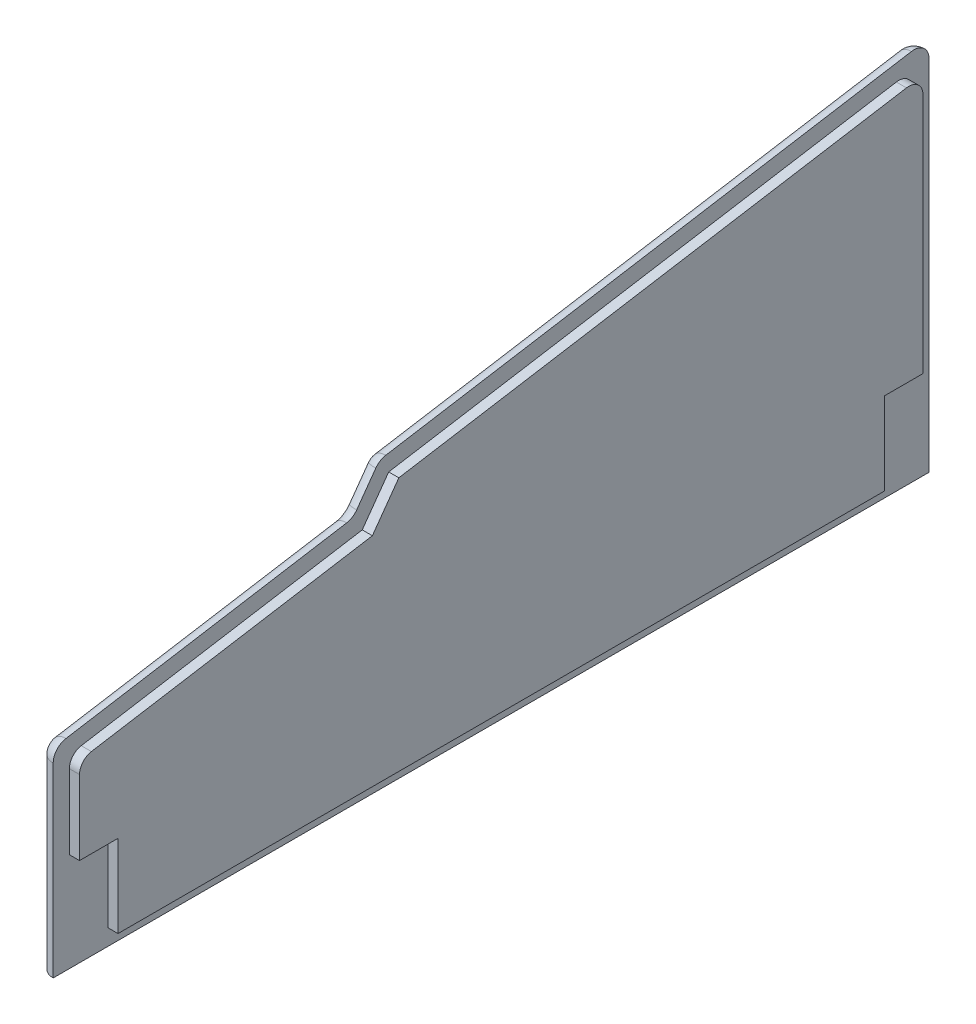
from build123d import *

# Parameters (mm, degrees)
BOSS_EXTRUDE1_DEPTH = 2
BOSS_EXTRUDE2_START = 3
BOSS_EXTRUDE2_DEPTH = 3
FILLET1_R           = 3


with BuildPart() as part:
    # Sketch1 → Boss-Extrude1 (new body)
    with BuildSketch(Plane.ZY.offset(329.974562358)):
        with BuildLine():
            Line((137.105001839, 14.690261729), (137.105001839, -0.019509128))
            Line((137.105001839, -0.019509128), (133.705001839, -0.019509128))
            Line((133.705001839, -0.019509128), (129.505001839, -0.019509128))
            Line((129.505001839, -0.019509128), (129.505001839, -16.302112125))
            Line((129.505001839, -16.302112125), (-21.848970599, -16.302112125))
            Line((-21.848970599, -16.302112125), (-21.848970599, -0.019509128))
            Line((-21.848970599, -0.019509128), (-26.048970599, -0.019509128))
            Line((-26.048970599, -0.019509128), (-29.448970599, -0.019509128))
            Line((-29.448970599, -0.019509128), (-29.448970599, 47.708117707))
            ThreePointArc((-29.448970599, 47.708117707), (-28.460366767, 49.843262649), (-26.192653512, 50.470684397))
            Line((-26.192653512, 50.470684397), (74.05116687, 33.912543624))
            Line((74.05116687, 33.912543624), (79.277875997, 26.617509644))
            Line((79.277875997, 26.617509644), (134.761318926, 17.452828418))
            ThreePointArc((134.761318926, 17.452828418), (136.440146781, 16.501657897), (137.105001839, 14.690261729))
        make_face()
    extrude(amount=-BOSS_EXTRUDE1_DEPTH)

    # Sketch1<4> → Boss-Extrude2 (add)
    # profile 1 of 3: a face of its own
    with BuildSketch(Plane.ZY.offset(329.974562358).offset(BOSS_EXTRUDE2_START)):
        with BuildLine():
            Line((-32.648970599, -19.502112125), (140.305001839, -19.502112125))
            Line((140.305001839, -19.502112125), (140.305001839, -10.219509128))
            Line((140.305001839, -10.219509128), (133.705001839, -10.219509128))
            Line((133.705001839, -10.219509128), (133.705001839, -0.219509128))
            Line((133.705001839, -0.219509128), (137.305001839, -0.219509128))
            Line((137.305001839, -0.219509128), (137.305001839, 14.690261729))
            ThreePointArc((137.305001839, 14.690261729), (136.592657134, 16.631043337), (134.793913004, 17.650154611))
            Line((134.793913004, 17.650154611), (79.39220526, 26.801334927))
            Line((79.39220526, 26.801334927), (74.165496133, 34.096368907))
            Line((74.165496133, 34.096368907), (-26.160059434, 50.668010589))
            ThreePointArc((-26.160059434, 50.668010589), (-28.589752208, 49.995773002), (-29.648970599, 47.708117707))
            Line((-29.648970599, 47.708117707), (-29.648970599, -0.219509128))
            Line((-29.648970599, -0.219509128), (-26.048970599, -0.219509128))
            Line((-26.048970599, -0.219509128), (-26.048970599, -10.219509128))
            Line((-26.048970599, -10.219509128), (-32.648970599, -10.219509128))
            Line((-32.648970599, -10.219509128), (-32.648970599, -19.502112125))
        make_face()
        with BuildLine():
            ThreePointArc((137.105001839, 14.690261729), (136.440146781, 16.501657897), (134.761318926, 17.452828418))
            Line((134.761318926, 17.452828418), (79.277875997, 26.617509644))
            Line((79.277875997, 26.617509644), (74.05116687, 33.912543624))
            Line((74.05116687, 33.912543624), (-26.192653512, 50.470684397))
            ThreePointArc((-26.192653512, 50.470684397), (-28.460366767, 49.843262649), (-29.448970599, 47.708117707))
            Line((-29.448970599, 47.708117707), (-29.448970599, -0.019509128))
            Line((-29.448970599, -0.019509128), (-26.048970599, -0.019509128))
            Line((-26.048970599, -0.019509128), (-21.848970599, -0.019509128))
            Line((-21.848970599, -0.019509128), (-21.848970599, -16.302112125))
            Line((-21.848970599, -16.302112125), (129.505001839, -16.302112125))
            Line((129.505001839, -16.302112125), (129.505001839, -0.019509128))
            Line((129.505001839, -0.019509128), (133.705001839, -0.019509128))
            Line((133.705001839, -0.019509128), (137.105001839, -0.019509128))
            Line((137.105001839, -0.019509128), (137.105001839, 14.690261729))
        make_face(mode=Mode.SUBTRACT)
    # profile 2 of 3: a face of its own
    with BuildSketch(Plane.ZY.offset(329.974562358).offset(BOSS_EXTRUDE2_START)):
        with BuildLine():
            ThreePointArc((76.604168861, 35.843616835), (75.749893119, 36.643855156), (74.654407298, 37.056261789))
            Line((74.654407298, 37.056261789), (-29.160059434, 54.204197172))
            ThreePointArc((-29.160059434, 54.204197172), (-31.589752208, 53.531959584), (-32.648970599, 51.24430429))
            Line((-32.648970599, 51.24430429), (-32.648970599, -10.219509128))
            Line((-32.648970599, -10.219509128), (-26.048970599, -10.219509128))
            Line((-26.048970599, -10.219509128), (-26.048970599, -0.219509128))
            Line((-26.048970599, -0.219509128), (-29.648970599, -0.219509128))
            Line((-29.648970599, -0.219509128), (-29.648970599, 47.708117707))
            ThreePointArc((-29.648970599, 47.708117707), (-28.589752208, 49.995773002), (-26.160059434, 50.668010589))
            Line((-26.160059434, 50.668010589), (74.165496133, 34.096368907))
            Line((74.165496133, 34.096368907), (79.39220526, 26.801334927))
            Line((79.39220526, 26.801334927), (134.793913004, 17.650154611))
            ThreePointArc((134.793913004, 17.650154611), (136.592657134, 16.631043337), (137.305001839, 14.690261729))
            Line((137.305001839, 14.690261729), (137.305001839, -0.219509128))
            Line((137.305001839, -0.219509128), (133.705001839, -0.219509128))
            Line((133.705001839, -0.219509128), (133.705001839, -10.219509128))
            Line((133.705001839, -10.219509128), (140.305001839, -10.219509128))
            Line((140.305001839, -10.219509128), (140.305001839, 17.2353763))
            ThreePointArc((140.305001839, 17.2353763), (139.592657134, 19.176157909), (137.793913004, 20.195269182))
            Line((137.793913004, 20.195269182), (82.333171975, 29.356200538))
            ThreePointArc((82.333171975, 29.356200538), (81.237686153, 29.768607171), (80.383410411, 30.568845492))
            Line((80.383410411, 30.568845492), (76.604168861, 35.843616835))
        make_face()
    # profile 3 of 3: a face of its own
    with BuildSketch(Plane.ZY.offset(329.974562358).offset(BOSS_EXTRUDE2_START)):
        with BuildLine():
            Line((137.105001839, 14.690261729), (137.105001839, -0.019509128))
            Line((137.105001839, -0.019509128), (133.705001839, -0.019509128))
            Line((133.705001839, -0.019509128), (129.505001839, -0.019509128))
            Line((129.505001839, -0.019509128), (129.505001839, -16.302112125))
            Line((129.505001839, -16.302112125), (-21.848970599, -16.302112125))
            Line((-21.848970599, -16.302112125), (-21.848970599, -0.019509128))
            Line((-21.848970599, -0.019509128), (-26.048970599, -0.019509128))
            Line((-26.048970599, -0.019509128), (-29.448970599, -0.019509128))
            Line((-29.448970599, -0.019509128), (-29.448970599, 47.708117707))
            ThreePointArc((-29.448970599, 47.708117707), (-28.460366767, 49.843262649), (-26.192653512, 50.470684397))
            Line((-26.192653512, 50.470684397), (74.05116687, 33.912543624))
            Line((74.05116687, 33.912543624), (79.277875997, 26.617509644))
            Line((79.277875997, 26.617509644), (134.761318926, 17.452828418))
            ThreePointArc((134.761318926, 17.452828418), (136.440146781, 16.501657897), (137.105001839, 14.690261729))
        make_face()
    extrude(amount=-BOSS_EXTRUDE2_DEPTH)

    # Fillet1
    fillet1_edges = [part.edges().sort_by_distance(p)[0] for p in [
        (-332.974562358, 15.871096082, -32.648970599),
        (-332.974562358, 53.531959584, -31.589752208),
        (-332.974562358, 45.63022948, 22.747173932),
        (-332.974562358, 36.643855156, 75.749893119),
        (-332.974562358, 33.206231163, 78.493789636),
        (-332.974562358, 29.768607171, 81.237686153),
        (-332.974562358, 24.77573486, 110.063542489),
        (-332.974562358, 19.176157909, 139.592657134),
        (-332.974562358, -1.133367912, 140.305001839),
    ]]
    fillet(fillet1_edges, radius=FILLET1_R - 0.0001)  # a hair under: the kernel refuses the full size


with BuildPart() as body_2:
    # Mirror1: mirrored copy
    add(part.part.mirror(Plane.ZY.offset(327.974562358)))


solid = part.part
